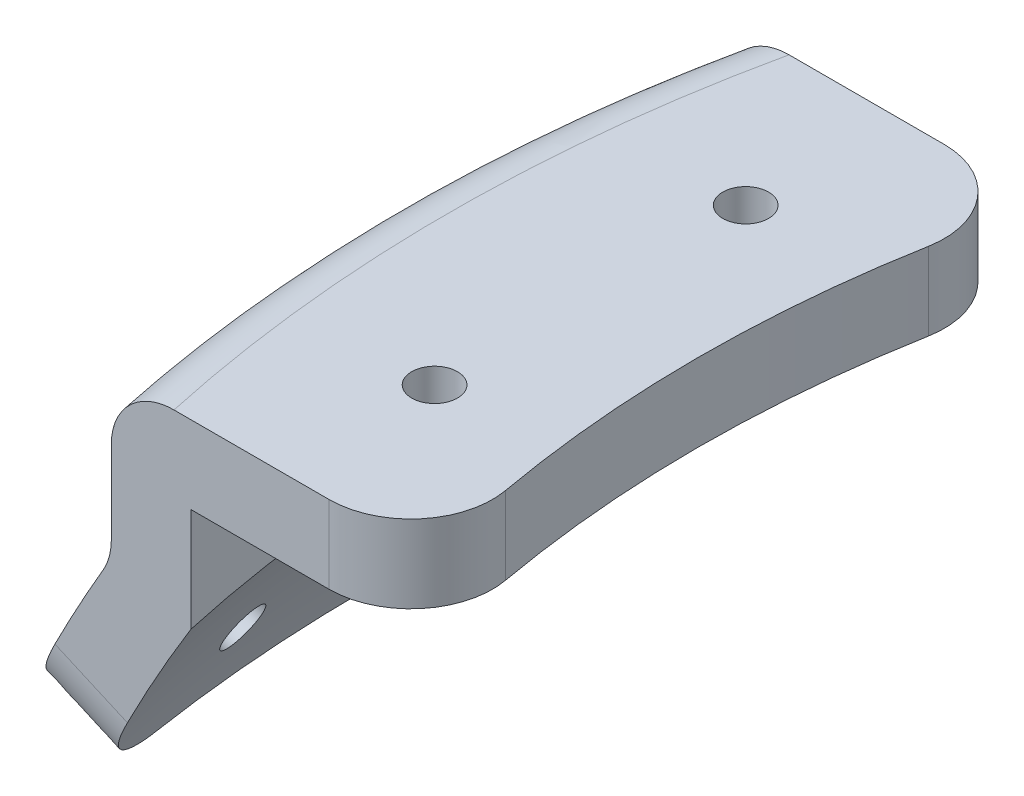
from build123d import *

# Parameters (mm, degrees)
REVOLVE1_ANGLE          = 30
FILLET1_R               = 7.5
CUT_EXTRUDE1_DEPTH      = 204.770565852
CUT_EXTRUDE1_DEPTH_BACK = 204.770565852
SKETCH3_R               = 2.805
SKETCH4_OUTSIDE_W       = 80.274
SKETCH4_OUTSIDE_H       = 127.092
SKETCH4_OUTSIDE_W_2     = 74.859969382
SKETCH4_OUTSIDE_H_2     = 75.329921726
CUT_EXTRUDE2_DEPTH      = 206.615435906
FILLET2_R               = 10


with BuildPart() as part:
    # Sketch2 → Revolve1 (revolve, symmetric)
    with BuildSketch(Plane.XY) as revolve1_sk:
        with BuildLine():
            Line((-194.358193928, 176.356373685), (-185.655588229, 172.48464551))
            ThreePointArc((-185.655588229, 172.48464551), (-180.220069996, 183.754525728), (-174.101233777, 194.668503093))
            Line((-174.101233777, 194.668503093), (-174.101233777, 207.368503093))
            Line((-174.101233777, 207.368503093), (-145.526233777, 207.368503093))
            Line((-145.526233777, 207.368503093), (-145.526233777, 216.893512792))
            Line((-145.526233777, 216.893512792), (-183.626233777, 216.893512792))
            Line((-183.626233777, 216.893512792), (-183.626233777, 197.281129034))
            ThreePointArc((-183.626233777, 197.281129034), (-189.281584533, 186.967164785), (-194.358193928, 176.356373685))
        make_face()
    revolve(axis=Axis((0, 0, 0), (0, 1, 0)), revolution_arc=REVOLVE1_ANGLE / 2)
    revolve(revolve1_sk.sketch, axis=Axis((0, 0, 0), (0, -1, 0)), revolution_arc=REVOLVE1_ANGLE / 2)

    # Fillet1
    fillet1_edges = [part.edges().sort_by_distance(p)[0] for p in [
        (-183.626233777, 197.281129034, 0),
        (-183.626233777, 216.893512792, 0),
    ]]
    fillet(fillet1_edges, radius=FILLET1_R)

    # Sketch3 → Cut-Extrude1 (cut, two sides: drawn at the far end of the back side and taken through both)
    with BuildSketch(Plane.XZ.offset(-207.368503093).offset(-CUT_EXTRUDE1_DEPTH_BACK)):
        with Locations((-158.75, -19.05)):
            Circle(SKETCH3_R)
        with Locations((-158.75, 19.05)):
            Circle(SKETCH3_R)
    extrude(amount=CUT_EXTRUDE1_DEPTH + CUT_EXTRUDE1_DEPTH_BACK, mode=Mode.SUBTRACT)

    # Sketch4 outside → Cut-Extrude2 (cut, through all)
    with BuildSketch(Plane(origin=(0, 216.893512792, 0), x_dir=(1, 0, 0), z_dir=(0, 1, 0))):
        with Locations((-167.463, 0)):
            Rectangle(SKETCH4_OUTSIDE_W, SKETCH4_OUTSIDE_H)
        with Locations((-177.997532298, 0)):
            Rectangle(SKETCH4_OUTSIDE_W_2, SKETCH4_OUTSIDE_H_2, mode=Mode.SUBTRACT)
    extrude(amount=-CUT_EXTRUDE2_DEPTH, mode=Mode.SUBTRACT)

    # Fillet2
    fillet2_edges = [part.edges().sort_by_distance(p)[0] for p in [
        (-186.234578706, 174.419747362, 37.664960863),
        (-186.234578706, 174.419747362, -37.664960863),
        (-140.567547607, 212.131007942, -37.664960863),
        (-140.567547607, 212.131007942, 37.664960863),
    ]]
    fillet(fillet2_edges, radius=FILLET2_R)

    # Sketch6 → Cut-Revolve1 (revolve, cut)
    with BuildSketch(Plane(origin=(36.360369904, 71.361243959, 0), x_dir=(-0.8910065241883691, 0.4539904997395443, 0), z_dir=(0.4539904997395443, 0.8910065241883691, 0))):
        Polygon((216.837700771, 18.970840643), (271.242197983, 23.730617393), (270.997726125, 26.524943522), (216.593228913, 21.765166771), align=None)
    cut_revolve1 = revolve(axis=Axis((-156.843436173, 169.803500094, 18.970840643), (-0.887615975361608, 0.4522629288245561, 0.08715574274765836)), mode=Mode.SUBTRACT)

    # Mirror1: Cut-Revolve1 across plane
    add(cut_revolve1.mirror(Plane.XY), mode=Mode.SUBTRACT)


solid = part.part
